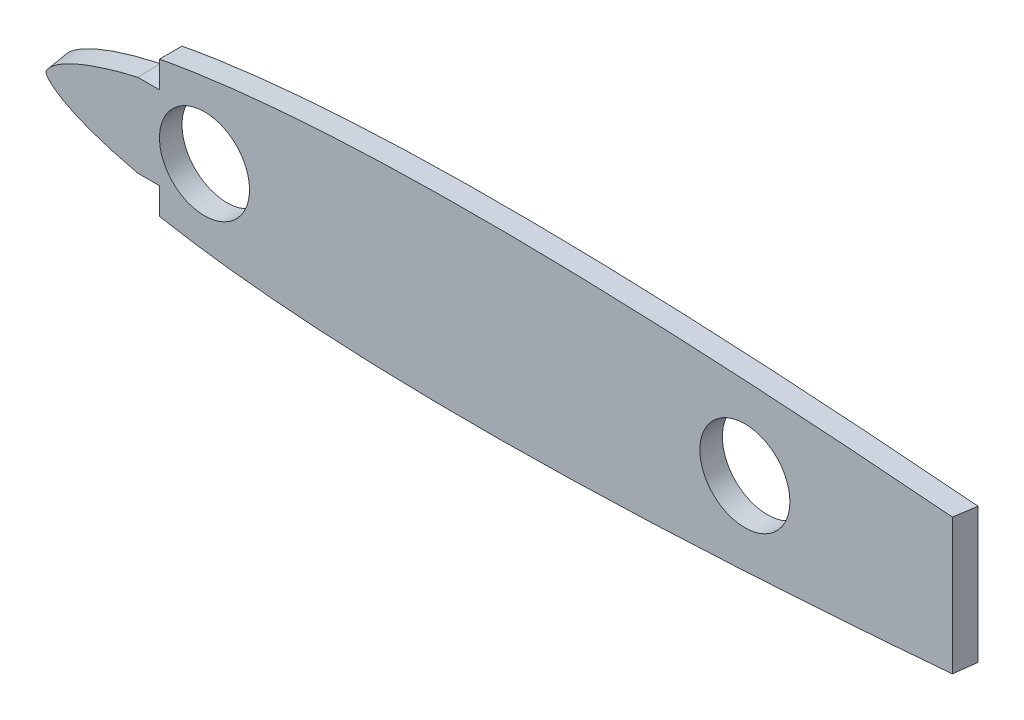
from build123d import *

# Parameters (mm, degrees)
BOSS_EXTRUDE1_DEPTH     = 3.175
SKETCH2_R               = 6.35
CUT_EXTRUDE1_DEPTH      = 215.62714732
CUT_EXTRUDE2_DEPTH      = 215.62714732
CUT_EXTRUDE2_DEPTH_BACK = 215.62714732


with BuildPart() as part:
    # Sketch1 → Boss-Extrude1 (new body)
    with BuildSketch(Plane.XY):
        with BuildLine():
            add(Edge.make_bspline(
                [(214.122, 0.26979372), (214.042517561, 0.336401081), (213.528971009, 0.273510814), (212.614475706, 0.530942112), (210.937412976, 0.69005818), (208.678154781, 1.031540783), (205.767891794, 1.412612557), (202.258298365, 1.882266), (198.158505405, 2.4131646), (193.498201346, 3.004251359), (188.3046229, 3.645171414), (182.610259265, 4.327250831), (176.450111776, 5.042029836), (169.862114854, 5.779776892), (162.886908752, 6.531484704), (155.567547263, 7.287816965), (147.949138879, 8.039011284), (140.078674392, 8.774523149), (132.004623532, 9.484696808), (123.776853773, 10.157659428), (115.445921162, 10.782438327), (107.063264355, 11.347433986), (98.680532246, 11.840832833), (90.349330839, 12.250169768), (82.121113367, 12.564529441), (74.046372156, 12.77365626), (66.175007458, 12.867335678), (58.555385553, 12.838133258), (51.234483397, 12.680408315), (44.257364483, 12.390162696), (37.666974317, 11.966637162), (31.503817676, 11.411106073), (25.805608692, 10.727908153), (20.607079774, 9.922856403), (15.939732749, 9.004358901), (11.830923582, 7.982801344), (8.304000309, 6.868145192), (5.376882013, 5.670771919), (3.058903356, 4.398782317), (1.353631156, 3.049665872), (0.261418186, 1.590784391), (-0.121830169, 0), (0.261418186, -1.590784391), (1.353631156, -3.049665872), (3.058903356, -4.398782317), (5.376882013, -5.670771919), (8.304000309, -6.868145192), (11.830923582, -7.982801344), (15.939732749, -9.004358901), (20.607079774, -9.922856403), (25.805608692, -10.727908153), (31.503817676, -11.411106073), (37.666974317, -11.966637162), (44.257364483, -12.390162696), (51.234483397, -12.680408315), (58.555385553, -12.838133258), (66.175007458, -12.867335678), (74.046372156, -12.77365626), (82.121113367, -12.564529441), (90.349330839, -12.250169768), (98.680532246, -11.840832833), (107.063264355, -11.347433986), (115.445921162, -10.782438327), (123.776853773, -10.157659428), (132.004623532, -9.484696808), (140.078674392, -8.774523149), (147.949138879, -8.039011284), (155.567547263, -7.287816965), (162.886908752, -6.531484704), (169.862114854, -5.779776892), (176.450111776, -5.042029836), (182.610259265, -4.327250831), (188.3046229, -3.645171414), (193.498201346, -3.004251359), (198.158505405, -2.4131646), (202.258298365, -1.882266), (205.767891794, -1.412612557), (208.678154781, -1.031540783), (210.937412976, -0.69005818), (212.614475706, -0.530942112), (213.528971009, -0.273510814), (214.25071943, -0.361898032), (214.25071943, 0.161925093), (214.122, 0.26979372)],
                knots=[0, 0, 0, 0, 0.000762215, 0.003044706, 0.006832246, 0.012101176, 0.018817536, 0.026939455, 0.036414848, 0.047184629, 0.059180413, 0.072327874, 0.086544061, 0.10174058, 0.117823336, 0.134691452, 0.152240154, 0.17036129, 0.188941008, 0.207865435, 0.227016078, 0.246275696, 0.265524943, 0.284644966, 0.303520118, 0.322034575, 0.340078353, 0.357542593, 0.374325482, 0.390329891, 0.40546389, 0.419643801, 0.432793371, 0.444843817, 0.455737921, 0.465428653, 0.47388632, 0.481101634, 0.487101684, 0.491975368, 0.495930678, 0.499382808, 0.502834938, 0.506790248, 0.511663932, 0.517663982, 0.524879296, 0.533336963, 0.543027695, 0.553921799, 0.565972245, 0.579121815, 0.593301726, 0.608435725, 0.624440134, 0.641223023, 0.658687263, 0.676731041, 0.695245498, 0.71412065, 0.733240673, 0.75248992, 0.771749538, 0.790900181, 0.809824608, 0.828404326, 0.846525462, 0.864074164, 0.88094228, 0.897025036, 0.912221555, 0.926437743, 0.939585203, 0.951580988, 0.962350768, 0.971826161, 0.979948081, 0.98666444, 0.991933371, 0.99572091, 0.998003402, 0.998765616, 1, 1, 1, 1], degree=3))
        make_face()
    extrude(amount=BOSS_EXTRUDE1_DEPTH)

    # Sketch2 → Cut-Extrude1 (cut, through all)
    with BuildSketch(Plane.XY.offset(3.175)):
        with Locations((25.4, 0)):
            Circle(SKETCH2_R)
        with Locations((101.6, 0)):
            Circle(SKETCH2_R)
    extrude(amount=-CUT_EXTRUDE1_DEPTH, mode=Mode.SUBTRACT)

    # Sketch4 → Cut-Extrude2 (cut, two sides: drawn at the far end of the back side and taken through both)
    with BuildSketch(Plane(origin=(0, 0, 0), x_dir=(1, 0, 0), z_dir=(0, 1, 0)).offset(-CUT_EXTRUDE2_DEPTH_BACK)):
        Polygon((131.301372669, 0), (130.854723983, -3.175), (214.218539573, -3.175), (214.218539573, 0), align=None)
    extrude(amount=CUT_EXTRUDE2_DEPTH + CUT_EXTRUDE2_DEPTH_BACK, mode=Mode.SUBTRACT)

    # Sketch6 → Cut-Loft1 section 0
    with BuildSketch(Plane.XY.offset(3.175)):
        with BuildLine():
            Line((19.05, -5.856388973), (19.05, -9.60451625))
            Line((19.05, -9.60451625), (19.05, -13.496705478))
            Line((19.05, -13.496705478), (-3.17679028, -18.7418168))
            Line((-3.17679028, -18.7418168), (-7.400210772, 8.670878009))
            Line((-7.400210772, 8.670878009), (19.05, 13.499844305))
            Line((19.05, 13.499844305), (19.05, 9.60451625))
            Line((19.05, 9.60451625), (19.05, 5.856388972))
            Line((19.05, 5.856388972), (16.002, 5.855689085))
            add(Edge.make_bspline(
                [(16.002, 5.855689085), (15.278985699, 5.689672728), (14.191834186, 5.424851558), (12.757843363, 5.037907465), (11.69367278, 4.729775055), (10.646700316, 4.403337894), (9.617692504, 4.055796047), (8.608301637, 3.684577658), (7.626216232, 3.28790719), (6.678573411, 2.8637313), (5.779182107, 2.40890834), (5.078910801, 2.000461241), (4.5709467, 1.665455737), (4.220151013, 1.411514439), (3.905914023, 1.157647081), (3.631157505, 0.904651906), (3.399885574, 0.653944439), (3.226743451, 0.433066972), (3.126676284, 0.2697322), (3.07552602, 0.144421915), (3.049218429, 0.037663177), (3.047390298, 5.5e-08), (3.04921854, -0.03766331), (3.075525744, -0.1444217), (3.126676947, -0.269732641), (3.226742145, -0.433066135), (3.399888053, -0.653946015), (3.631152817, -0.904648933), (3.905923107, -1.157652839), (4.220131475, -1.411502059), (4.570981553, -1.665477812), (5.078773369, -2.000374258), (5.77925724, -2.408956031), (6.678536824, -2.863707828), (7.626233895, -3.287919031), (8.608295197, -3.684572243), (9.617690306, -4.05579733), (10.64671253, -4.403340225), (11.693641898, -4.729767367), (12.757897505, -5.037921267), (14.191640812, -5.424801637), (15.278985699, -5.689672728), (16.002, -5.855689085)],
                knots=[0, 0, 0, 0, 0.0625, 0.09375, 0.125, 0.15625, 0.1875, 0.21875, 0.25, 0.28125, 0.3125, 0.34375, 0.359375, 0.375, 0.390625, 0.40625, 0.421875, 0.4375, 0.453125, 0.46875, 0.484375, 0.5, 0.515625, 0.53125, 0.546875, 0.5625, 0.578125, 0.59375, 0.609375, 0.625, 0.640625, 0.65625, 0.6875, 0.71875, 0.75, 0.78125, 0.8125, 0.84375, 0.875, 0.90625, 0.9375, 1, 1, 1, 1], degree=3))
            Line((16.002, -5.855689085), (19.05, -5.856388973))
        make_face()
    # Sketch5 → Cut-Loft1 section 1
    with BuildSketch(Plane(origin=(0, 0, 0), x_dir=(-1, 0, 0), z_dir=(0, 0, -1))):
        with BuildLine():
            Line((-19.05, -9.69489598), (-19.05, -5.952242124))
            Line((-19.05, -5.952242124), (-16.002, -5.952242124))
            add(Edge.make_bspline(
                [(-16.002, 5.952242124), (-15.254770655, 5.78657596), (-14.131320952, 5.521981031), (-12.64893123, 5.134599211), (-11.548436123, 4.825723352), (-10.465051878, 4.498073941), (-9.399590771, 4.148800211), (-8.353696965, 3.775270971), (-7.504851445, 3.442218555), (-6.842934482, 3.161623807), (-6.194794877, 2.871042337), (-5.414728041, 2.488039147), (-4.683877816, 2.074629942), (-4.151373193, 1.734752799), (-3.782164679, 1.476616997), (-3.449549124, 1.21792525), (-3.156545696, 0.959314296), (-2.90735717, 0.702084345), (-2.716911913, 0.473376027), (-2.620007494, 0.329250424), (-2.568278365, 0.232230216), (-2.539730887, 0.166366119), (-2.518563335, 0.105023254), (-2.505407276, 0.055343345), (-2.499698937, 0.022962059), (-2.498722808, 3.7e-08), (-2.499699014, -0.022962102), (-2.505407277, -0.055343359), (-2.518563346, -0.105023288), (-2.539730598, -0.166365891), (-2.568278462, -0.232230258), (-2.620012631, -0.329254292), (-2.716907842, -0.47337309), (-2.907361053, -0.702086989), (-3.156540251, -0.959310743), (-3.449558648, -1.217931354), (-3.782145051, -1.476604524), (-4.151407833, -1.734774759), (-4.683741695, -2.074543768), (-5.414804155, -2.48808676), (-6.194777113, -2.871030834), (-6.84292503, -3.16161805), (-7.50486635, -3.442227642), (-8.353689563, -3.77526546), (-9.399589141, -4.148801556), (-10.465063669, -4.498076208), (-11.54840573, -4.825715767), (-12.648984703, -5.134612855), (-14.131129756, -5.52193166), (-15.254770655, -5.78657596), (-16.002, -5.952242124)],
                knots=[0, 0, 0, 0, 0.0625, 0.09375, 0.125, 0.15625, 0.1875, 0.21875, 0.25, 0.265625, 0.28125, 0.3125, 0.34375, 0.359375, 0.375, 0.390625, 0.40625, 0.421875, 0.4375, 0.453125, 0.4609375, 0.46875, 0.4765625, 0.484375, 0.4921875, 0.5, 0.5078125, 0.515625, 0.5234375, 0.53125, 0.5390625, 0.546875, 0.5625, 0.578125, 0.59375, 0.609375, 0.625, 0.640625, 0.65625, 0.6875, 0.71875, 0.734375, 0.75, 0.78125, 0.8125, 0.84375, 0.875, 0.90625, 0.9375, 1, 1, 1, 1], degree=3))
            Line((-16.002, 5.952242124), (-19.05, 5.952242124))
            Line((-19.05, 5.952242124), (-19.05, 9.69489598))
            Line((-19.05, 9.69489598), (-19.05, 12.377646409))
            Line((-19.05, 12.377646409), (3.93721866, 8.635694366))
            Line((3.93721866, 8.635694366), (2.51171312, -11.744580154))
            Line((2.51171312, -11.744580154), (-19.05, -12.301418255))
            Line((-19.05, -12.301418255), (-19.05, -9.69489598))
        make_face()
    loft(mode=Mode.SUBTRACT)


solid = part.part
